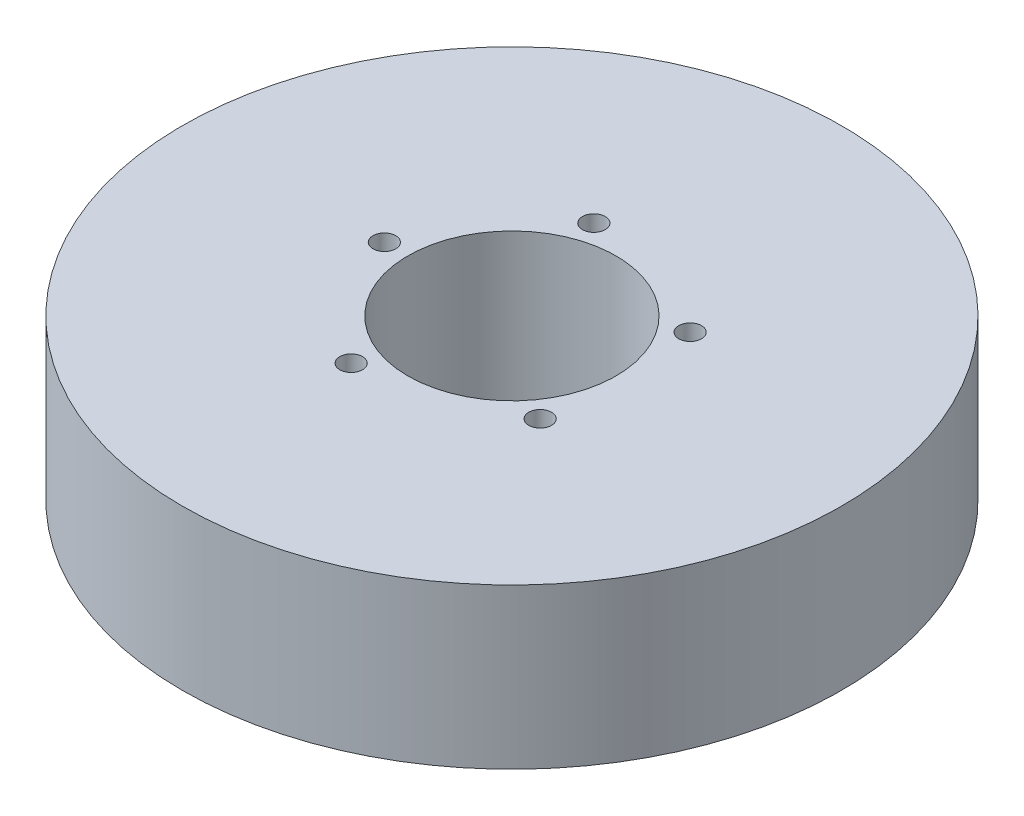
from build123d import *

# Parameters (mm, degrees)
SKETCH1_R           = 47.5
BOSS_EXTRUDE1_DEPTH = 23
SKETCH2_R           = 15
CUT_EXTRUDE1_DEPTH  = 72.003521039
SKETCH3_R           = 1.643277369
CUT_EXTRUDE2_DEPTH  = 19.998113982
CIRPATTERN1_COUNT   = 5


with BuildPart() as part:
    # Sketch1 → Boss-Extrude1 (new body)
    with BuildSketch(Plane(origin=(0, 0, 0), x_dir=(1, 0, 0), z_dir=(0, 1, 0))):
        Circle(SKETCH1_R)
    extrude(amount=BOSS_EXTRUDE1_DEPTH)

    # Sketch2 → Cut-Extrude1 (cut, through all)
    with BuildSketch(Plane(origin=(0, 0, 0), x_dir=(1, 0, 0), z_dir=(0, 1, 0))):
        Circle(SKETCH2_R)
    extrude(amount=CUT_EXTRUDE1_DEPTH, mode=Mode.SUBTRACT)

    # Sketch3 → Cut-Extrude2 (cut)
    with BuildSketch(Plane(origin=(0, 23, 0), x_dir=(1, 0, 0), z_dir=(0, 1, 0))):
        with Locations((-18.389047802, 0)):
            Circle(SKETCH3_R)
    cut_extrude2 = extrude(amount=-CUT_EXTRUDE2_DEPTH, mode=Mode.SUBTRACT)

    # CirPattern1: Cut-Extrude2 ×5 about axis
    cirpattern1_axis = Axis((0, 0, 0), (0, 1, 0))
    for i in range(1, CIRPATTERN1_COUNT):
        add(cut_extrude2.rotate(cirpattern1_axis, i * 360 / CIRPATTERN1_COUNT), mode=Mode.SUBTRACT)


solid = part.part
